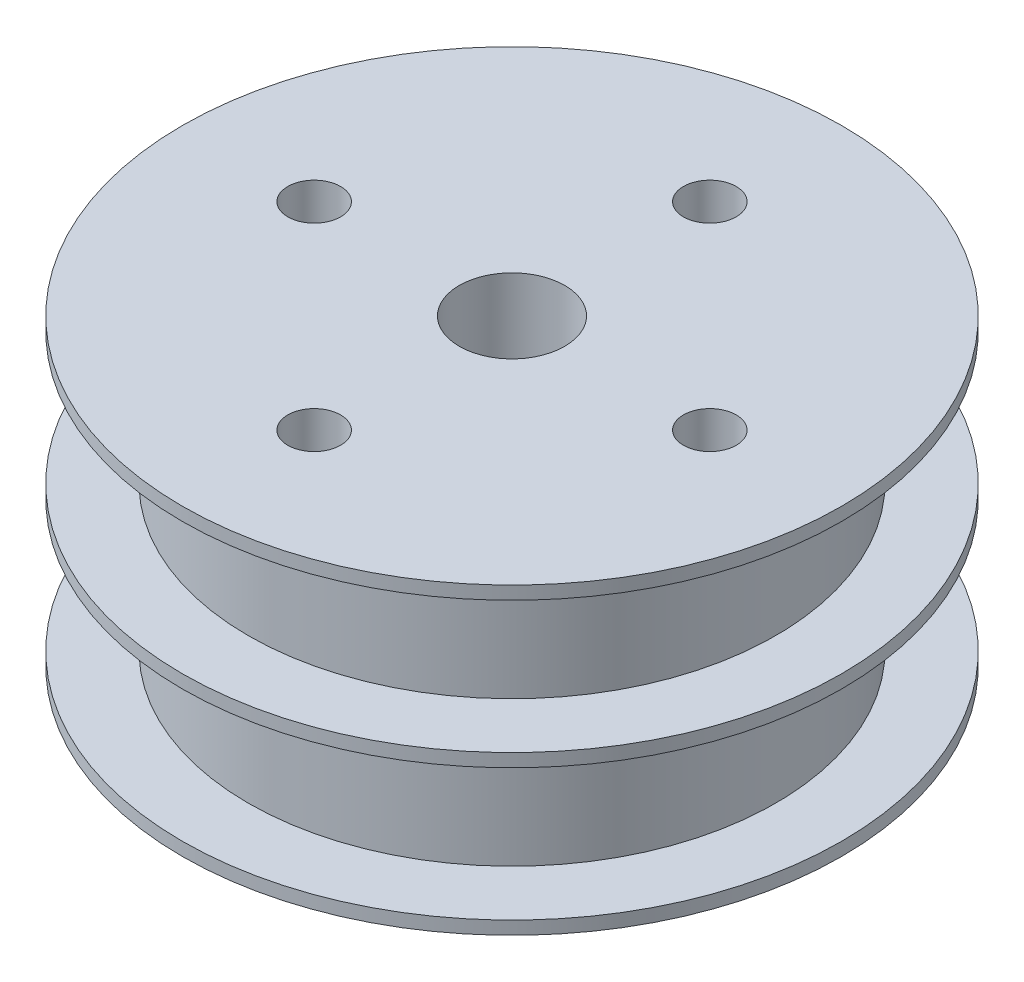
from build123d import *

# Parameters (mm, degrees)
SKETCH_1_R      = 20
SKETCH_1_R_2    = 2
SKETCH_1_R_3    = 4
EXTRUDE_1_DEPTH = 10
SKETCH_2_R      = 25
SKETCH_2_R_2    = 4
SKETCH_2_R_3    = 2
EXTRUDE_2_DEPTH = 1
EXTRUDE_START   = 1
SKETCH_3_R      = 25
SKETCH_3_R_2    = 4
SKETCH_3_R_3    = 2
EXTRUDE_3_DEPTH = 1
EXTRUDE_START_2 = 10
SKETCH_4_R      = 20
SKETCH_4_R_2    = 2
SKETCH_4_R_3    = 4
EXTRUDE_4_DEPTH = 10
SKETCH_5_R      = 25
SKETCH_5_R_2    = 2
SKETCH_5_R_3    = 4
EXTRUDE_5_DEPTH = 1


with BuildPart() as part:
    # 草图1 → 凸台-拉伸1 (new body)
    with BuildSketch(Plane(origin=(0, 0, 0), x_dir=(1, 0, 0), z_dir=(0, 1, 0))):
        Circle(SKETCH_1_R)
        with Locations((0, 15)):
            Circle(SKETCH_1_R_2, mode=Mode.SUBTRACT)
        with Locations((15, 0)):
            Circle(SKETCH_1_R_2, mode=Mode.SUBTRACT)
        with Locations((0, -15)):
            Circle(SKETCH_1_R_2, mode=Mode.SUBTRACT)
        with Locations((-15, 0)):
            Circle(SKETCH_1_R_2, mode=Mode.SUBTRACT)
        Circle(SKETCH_1_R_3, mode=Mode.SUBTRACT)
    extrude(amount=EXTRUDE_1_DEPTH)

    # 草图2 → 凸台-拉伸2 (add)
    with BuildSketch(Plane(origin=(0, 10, 0), x_dir=(1, 0, 0), z_dir=(0, 1, 0))):
        Circle(SKETCH_2_R)
        Circle(SKETCH_2_R_2, mode=Mode.SUBTRACT)
        with Locations((-15, 0)):
            Circle(SKETCH_2_R_3, mode=Mode.SUBTRACT)
        with Locations((0, 15)):
            Circle(SKETCH_2_R_3, mode=Mode.SUBTRACT)
        with Locations((15, 0)):
            Circle(SKETCH_2_R_3, mode=Mode.SUBTRACT)
        with Locations((0, -15)):
            Circle(SKETCH_2_R_3, mode=Mode.SUBTRACT)
    extrude(amount=EXTRUDE_2_DEPTH)

    # 草图3 → 凸台-拉伸3 (add)
    with BuildSketch(Plane.XZ.offset(EXTRUDE_START)):
        Circle(SKETCH_3_R)
        Circle(SKETCH_3_R_2, mode=Mode.SUBTRACT)
        with Locations((15, 0)):
            Circle(SKETCH_3_R_3, mode=Mode.SUBTRACT)
        with Locations((0, -15)):
            Circle(SKETCH_3_R_3, mode=Mode.SUBTRACT)
        with Locations((-15, 0)):
            Circle(SKETCH_3_R_3, mode=Mode.SUBTRACT)
        with Locations((0, 15)):
            Circle(SKETCH_3_R_3, mode=Mode.SUBTRACT)
    extrude(amount=-EXTRUDE_3_DEPTH)

    # 草图4 → 凸台-拉伸4 (add)
    with BuildSketch(Plane.XZ.offset(1).offset(EXTRUDE_START_2)):
        Circle(SKETCH_4_R)
        with Locations((0, 15)):
            Circle(SKETCH_4_R_2, mode=Mode.SUBTRACT)
        with Locations((15, 0)):
            Circle(SKETCH_4_R_2, mode=Mode.SUBTRACT)
        with Locations((0, -15)):
            Circle(SKETCH_4_R_2, mode=Mode.SUBTRACT)
        with Locations((-15, 0)):
            Circle(SKETCH_4_R_2, mode=Mode.SUBTRACT)
        Circle(SKETCH_4_R_3, mode=Mode.SUBTRACT)
    extrude(amount=-EXTRUDE_4_DEPTH)

    # 草图5 → 凸台-拉伸5 (add)
    with BuildSketch(Plane.XZ.offset(11).offset(EXTRUDE_START)):
        Circle(SKETCH_5_R)
        with Locations((15, 0)):
            Circle(SKETCH_5_R_2, mode=Mode.SUBTRACT)
        with Locations((0, -15)):
            Circle(SKETCH_5_R_2, mode=Mode.SUBTRACT)
        with Locations((-15, 0)):
            Circle(SKETCH_5_R_2, mode=Mode.SUBTRACT)
        with Locations((0, 15)):
            Circle(SKETCH_5_R_2, mode=Mode.SUBTRACT)
        Circle(SKETCH_5_R_3, mode=Mode.SUBTRACT)
    extrude(amount=-EXTRUDE_5_DEPTH)


solid = part.part
